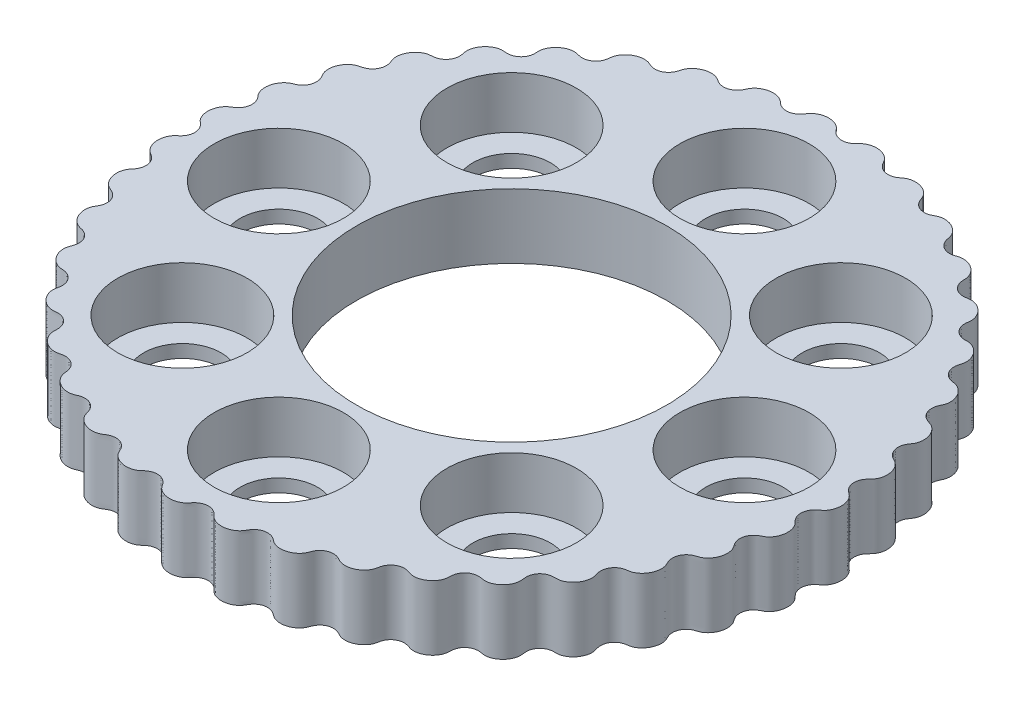
from build123d import *

# Parameters (mm, degrees)
BOSS_EXTRUDE1_START = -5
BOSS_EXTRUDE1_DEPTH = 5
SKETCH2_R           = 12
CUT_EXTRUDE1_DEPTH  = 37.393837929
HOLE1_D             = 6
HOLE1_CBORE_D       = 10
HOLE1_CBORE_DEPTH   = 4


# Read off the part's stored shape, not the designer's step: Boss-Extrude1
with BuildPart() as part:
    # Boss-Extrude1 outline → Boss-Extrude1 (new body)
    with BuildSketch(Plane(origin=(0, 0, 0), x_dir=(1, 0, 0), z_dir=(0, 1, 0)).offset(BOSS_EXTRUDE1_START)):
        with BuildLine():
            add(Edge.make_bspline(
                [(-24.5, 0), (-24.5, -0.032701576), (-24.503643768, -0.098935065), (-24.520100091, -0.231557515), (-24.563306694, -0.37104905), (-24.630474901, -0.517913129), (-24.723536717, -0.659065523), (-24.842442783, -0.7928284), (-24.987483311, -0.908750967), (-25.151066473, -1.063330899), (-25.293016734, -1.285136586), (-25.404935247, -1.590500327), (-25.442358966, -1.973679704), (-25.38823868, -2.341450404), (-25.249908885, -2.66266914), (-25.066237712, -2.923851671), (-24.843285183, -3.097823526), (-24.551710808, -3.251747242), (-24.291807967, -3.54096186), (-24.156855516, -3.887170811), (-24.159964194, -4.245303416), (-24.253524536, -4.539087991), (-24.385168226, -4.771968939), (-24.638807172, -5.019239879), (-24.797525081, -5.397374474), (-24.830645525, -5.836257731), (-24.734992758, -6.249812375), (-24.581951422, -6.558483237), (-24.390234292, -6.791981719), (-24.184935025, -6.970555692), (-23.94085472, -7.065125184), (-23.707134872, -7.165908686), (-23.508700988, -7.319059018), (-23.350412864, -7.502267836), (-23.216949119, -7.764654986), (-23.163202282, -8.071712168), (-23.205655501, -8.393877156), (-23.34132918, -8.675141437), (-23.491049397, -8.894217401), (-23.576162075, -9.177606246), (-23.598316799, -9.499805744), (-23.534839483, -9.847196252), (-23.379813294, -10.190594912), (-23.178906933, -10.450991492), (-22.96756741, -10.630525294), (-22.764880157, -10.74275699), (-22.589184753, -10.797744012), (-22.386815398, -10.837748422), (-22.190086382, -10.904416667), (-21.996608783, -11.016922345), (-21.76513704, -11.234569899), (-21.595631093, -11.535075827), (-21.539371142, -11.906162159), (-21.632077893, -12.284690709), (-21.764581584, -12.549564382), (-21.789593438, -12.787020834), (-21.782131101, -13.023382403), (-21.727181437, -13.289110069), (-21.595061725, -13.600213652), (-21.343195349, -13.928402362), (-21.015174886, -14.168242877), (-20.694719618, -14.280355121), (-20.431319471, -14.282746613), (-20.221891393, -14.310542506), (-20.031331556, -14.36570747), (-19.783881314, -14.493589438), (-19.520218355, -14.750869641), (-19.36908006, -15.105193451), (-19.358026871, -15.501401929), (-19.462600447, -15.833461084), (-19.464472528, -16.137599176), (-19.379692521, -16.467079717), (-19.20413738, -16.797533991), (-18.949742957, -17.076011559), (-18.638873722, -17.274855119), (-18.321682795, -17.389270014), (-18.023392019, -17.405995869), (-17.688466453, -17.348112947), (-17.287573892, -17.422084373), (-16.911103901, -17.660362808), (-16.700986872, -18.014992063), (-16.640562072, -18.330352656), (-16.644508032, -18.592116865), (-16.666618795, -18.826019771), (-16.606844181, -19.103025486), (-16.448349509, -19.431276821), (-16.17675271, -19.74491714), (-15.826597431, -19.975949914), (-15.461825487, -20.085392003), (-15.163898291, -20.094151901), (-14.9520024, -20.04983025), (-14.788464283, -20.001991557), (-14.620523702, -19.975251295), (-14.451471287, -19.973404927), (-14.183542561, -20.011245033), (-13.906637721, -20.136429947), (-13.663310323, -20.365573716), (-13.518257551, -20.65830567), (-13.463367138, -20.873569035), (-13.44582885, -21.065140218), (-13.425857037, -21.227322128), (-13.36659396, -21.418479957), (-13.257220726, -21.627293987), (-13.067172206, -21.864497208), (-12.77386147, -22.09369711), (-12.447891742, -22.2381968), (-12.113896745, -22.296901279), (-11.843875803, -22.283192923), (-11.645465782, -22.233946593), (-11.478617233, -22.156632069), (-11.326566326, -22.091661028), (-11.144171953, -22.042843551), (-10.932809135, -22.022823125), (-10.645185301, -22.057480963), (-10.36313677, -22.186462391), (-10.140796185, -22.389999876), (-9.978092873, -22.655161269), (-9.908251519, -22.873925164), (-9.860799898, -23.07866618), (-9.752494313, -23.294506537), (-9.598536128, -23.496595421), (-9.355144664, -23.704201957), (-9.012124755, -23.875609555), (-8.66866478, -23.951388952), (-8.351201207, -23.946909864), (-8.105808933, -23.889980993), (-7.933631169, -23.815733854), (-7.793147102, -23.723462426), (-7.667924542, -23.641344217), (-7.516461234, -23.566205542), (-7.337194888, -23.508022186), (-7.051498572, -23.471278437), (-6.693066545, -23.537697092), (-6.365459431, -23.748903968), (-6.15838792, -24.04864498), (-6.064280118, -24.29232027), (-5.94266348, -24.494976448), (-5.777090154, -24.672238128), (-5.520247176, -24.854790009), (-5.157666697, -24.994457904), (-4.786540585, -25.037338822), (-4.432716177, -24.988008571), (-4.169505595, -24.884468598), (-3.995068316, -24.768805386), (-3.865593658, -24.645272707), (-3.752469282, -24.54658182), (-3.609348281, -24.448937287), (-3.431420322, -24.364696016), (-3.162117221, -24.297268518), (-2.858943588, -24.3139032), (-2.575335523, -24.420915571), (-2.355767454, -24.590000535), (-2.22462643, -24.736967072), (-2.127382807, -24.881995349), (-2.043045448, -25.009111347), (-1.905164763, -25.158865949), (-1.698793066, -25.308147213), (-1.397681127, -25.439850098), (-1.001127395, -25.502965211), (-0.629360305, -25.465313735), (-0.307665354, -25.346652244), (-0.083554069, -25.198652632), (0.053247698, -25.060384837), (0.177849714, -24.89257545), (0.322474928, -24.735152105), (0.518785356, -24.595698929), (0.766051201, -24.499605539), (1.014597762, -24.467449994), (1.263114223, -24.492889288), (1.493381367, -24.576146017), (1.712279038, -24.70975623), (1.890397186, -24.901293648), (2.076369969, -25.098671242), (2.328663959, -25.228025659), (2.632218036, -25.321000864), (2.995349224, -25.341506798), (3.391344631, -25.269405651), (3.72570889, -25.09977043), (3.95025068, -24.900993909), (4.079020757, -24.71434247), (4.149949593, -24.578033634), (4.268658204, -24.384436791), (4.484903459, -24.15511427), (4.801886057, -23.992662584), (5.188898808, -23.961589643), (5.490584075, -24.041418853), (5.694287949, -24.146931727), (5.850720079, -24.266746804), (5.981065842, -24.369719817), (6.160403868, -24.467085708), (6.390667661, -24.53903357), (6.697487132, -24.571284513), (7.070614177, -24.521629504), (7.403348735, -24.388735097), (7.6790332, -24.191057237), (7.858081607, -23.988606232), (7.962893068, -23.812724541), (8.023941866, -23.63894966), (8.081282323, -23.483450289), (8.170475451, -23.317503843), (8.299773519, -23.150624459), (8.51964793, -22.965662498), (8.804465664, -22.847481619), (9.105365548, -22.822461222), (9.411188141, -22.884555599), (9.621121013, -22.98349187), (9.801541356, -23.093233385), (10.031431121, -23.167757955), (10.283339182, -23.1991326), (10.602501238, -23.170425043), (10.96378713, -23.044588284), (11.259514061, -22.852072044), (11.476293498, -22.621632584), (11.630063605, -22.37488496), (11.708363888, -22.123831617), (11.736343173, -21.861885355), (11.844524339, -21.617832178), (12.032186592, -21.353405878), (12.328822633, -21.137070409), (12.705385709, -21.042956367), (13.066996754, -21.097160652), (13.307409949, -21.19699775), (13.536665533, -21.25294426), (13.778370044, -21.258651437), (14.086089242, -21.203595279), (14.43196453, -21.045493553), (14.721938061, -20.816198287), (14.93081781, -20.535754089), (15.065261041, -20.246125029), (15.104422063, -19.966040419), (15.091955165, -19.636584102), (15.212438812, -19.266876657), (15.444788913, -18.97689371), (15.75647692, -18.800505601), (16.057689258, -18.734631758), (16.325183355, -18.732180031), (16.666141932, -18.828207188), (17.072976986, -18.776617763), (17.469630132, -18.585866424), (17.779960022, -18.296264144), (17.97076611, -18.009395532), (18.077132106, -17.726619708), (18.129143612, -17.459541547), (18.089017182, -17.200873303), (18.059424361, -16.948069734), (18.092832048, -16.699643254), (18.17234206, -16.470956663), (18.332828079, -16.224182753), (18.571854487, -16.024097886), (18.872076197, -15.89976473), (19.18349984, -15.876607566), (19.448092293, -15.89674078), (19.736076902, -15.828769616), (20.026191917, -15.686865131), (20.295309173, -15.458206322), (20.515197288, -15.152256297), (20.640263684, -14.848072182), (20.69008429, -14.575281206), (20.685945429, -14.343634509), (20.645728386, -14.163984922), (20.579190013, -13.96873148), (20.538550918, -13.765032883), (20.539232228, -13.541223617), (20.611966947, -13.231930145), (20.787450811, -12.934860177), (21.080687227, -12.70058262), (21.45485465, -12.591586679), (21.750490612, -12.573906328), (21.968640179, -12.476853149), (22.16960689, -12.352216642), (22.372265436, -12.171772873), (22.575637174, -11.901807468), (22.733936037, -11.519595898), (22.777646208, -11.115603109), (22.714525982, -10.78202278), (22.584907643, -10.552709026), (22.504249054, -10.357454845), (22.456753447, -10.164837398), (22.443729315, -9.88663199), (22.534743381, -9.52960091), (22.765917465, -9.221603372), (23.103644685, -9.013803993), (23.443302747, -8.93848596), (23.707993388, -8.787794965), (23.950263889, -8.550142022), (24.150007497, -8.231911496), (24.261724158, -7.874028052), (24.281866529, -7.502915555), (24.224809831, -7.211523413), (24.139392489, -7.004744406), (24.011104247, -6.82226928), (23.85764662, -6.606828878), (23.729838273, -6.261894362), (23.75128129, -5.814263941), (23.951133682, -5.456586685), (24.195158444, -5.24573212), (24.423265356, -5.118668919), (24.637193058, -5.020649097), (24.847031963, -4.83052053), (25.052168714, -4.529069776), (25.187932761, -4.137109686), (25.213001365, -3.718333125), (25.125395898, -3.347743358), (24.98406187, -3.085338558), (24.839762203, -2.92397556), (24.716507017, -2.806333566), (24.582959914, -2.64135003), (24.435425815, -2.363628599), (24.381922696, -2.017749906), (24.46873838, -1.650115993), (24.649609455, -1.378154529), (24.808636546, -1.22290269), (24.965741318, -1.111943307), (25.096247422, -1.01354666), (25.232180719, -0.866657231), (25.358361579, -0.667519532), (25.468779713, -0.384324166), (25.52063487, -0.015694947), (25.482799072, 0.338859248), (25.366652836, 0.65746471), (25.219778481, 0.884459885), (25.077933052, 1.031673708), (24.927554275, 1.137515001), (24.795258703, 1.236705561), (24.661779406, 1.370249009), (24.538753325, 1.543277464), (24.424946329, 1.809683062), (24.395606022, 2.118427635), (24.460685221, 2.412754545), (24.60895642, 2.686249863), (24.763487185, 2.856131501), (24.917080183, 2.999593705), (25.049860193, 3.201302755), (25.147903627, 3.435675741), (25.206010818, 3.750259953), (25.182955688, 4.133028667), (25.076862759, 4.468366378), (24.914260908, 4.741064395), (24.742269621, 4.925121935), (24.591886346, 5.037116558), (24.441737459, 5.112647712), (24.308008585, 5.180030924), (24.167201929, 5.273626283), (24.027175357, 5.39977741), (23.852494496, 5.628818837), (23.730781566, 5.97243798), (23.749873998, 6.361759057), (23.905908744, 6.69096743), (24.069879874, 6.894305009), (24.184586694, 7.100946871), (24.255321128, 7.332965465), (24.285005414, 7.646671699), (24.224682653, 8.030512224), (24.076266101, 8.37336121), (23.856641921, 8.655124843), (23.635374022, 8.831310243), (23.447990289, 8.924556985), (23.276267209, 8.974922862), (23.134229934, 9.023544198), (22.978107294, 9.098662652), (22.816193845, 9.210620433), (22.623144857, 9.410113226), (22.485950648, 9.680969687), (22.436801911, 9.98008468), (22.473435608, 10.254787922), (22.535133774, 10.441849709), (22.612106988, 10.598584097), (22.680029397, 10.735179487), (22.740790768, 10.929462915), (22.766895904, 11.182826769), (22.730409073, 11.509450231), (22.58680291, 11.884437962), (22.368321669, 12.187578491), (22.104717613, 12.406852976), (21.864496153, 12.526948008), (21.676356123, 12.576297924), (21.46873147, 12.600303477), (21.260084037, 12.646829282), (21.041148938, 12.747104754), (20.834288694, 12.913187543), (20.682161601, 13.112348827), (20.57992466, 13.340281649), (20.536879428, 13.581322073), (20.543127815, 13.837701159), (20.619935504, 14.087734533), (20.697897472, 14.347478833), (20.683785527, 14.630648163), (20.612539781, 14.940016116), (20.448750982, 15.264743668), (20.188340354, 15.571630982), (19.874283338, 15.776390436), (19.589894021, 15.871482493), (19.36387865, 15.889707248), (19.21037394, 15.882982814), (18.983382548, 15.888963222), (18.676671315, 15.96152072), (18.377464761, 16.154744804), (18.15698073, 16.474328537), (18.075213067, 16.775518481), (18.064704895, 17.004712505), (18.090236118, 17.200114634), (18.114255588, 17.364492919), (18.108933156, 17.568503025), (18.05612257, 17.803915684), (17.930651666, 18.085777039), (17.701086961, 18.384107556), (17.419631546, 18.605829356), (17.110599677, 18.74575099), (16.845749807, 18.799595204), (16.641024681, 18.802435079), (16.460004278, 18.768421708), (16.296666174, 18.74032546), (16.108358498, 18.734588923), (15.899193741, 18.763115029), (15.629078331, 18.861033277), (15.384315299, 19.048582015), (15.212178066, 19.296648554), (15.113024392, 19.592546165), (15.093725088, 19.823828753), (15.098560071, 20.03495203), (15.048167193, 20.271307402), (14.949392398, 20.505157697), (14.764958995, 20.76721217), (14.475345377, 21.017185785), (14.160763373, 21.177043605), (13.852808866, 21.249571591), (13.562235143, 21.259376095), (13.30566185, 21.201675588), (13.064820816, 21.094926346), (12.799373544, 21.066575462), (12.476542238, 21.096870076), (12.140863754, 21.245583401), (11.871066975, 21.524628459), (11.737189157, 21.864887947), (11.70343971, 22.123010648), (11.637276173, 22.349525601), (11.521374296, 22.56170531), (11.319844054, 22.800676046), (11.009992083, 23.021172245), (10.666434964, 23.157658483), (10.319123439, 23.198344141), (10.001074155, 23.169970497), (9.738921219, 23.06385688), (9.459849112, 22.888328302), (9.079427651, 22.80779713), (8.7121173, 22.864012386), (8.403512006, 23.045732045), (8.195848426, 23.273651905), (8.059966286, 23.504068249), (7.972655392, 23.847358434), (7.72457982, 24.173907852), (7.361059652, 24.422054498), (6.95509901, 24.546020162), (6.61125944, 24.567839428), (6.313185502, 24.518577693), (6.0558803, 24.430093425), (5.851919907, 24.266019209), (5.647785094, 24.113974915), (5.415939136, 24.018685882), (5.178139894, 23.973191799), (4.884194742, 23.988777252), (4.591403927, 24.095715796), (4.333607328, 24.293533833), (4.157819468, 24.551649253), (4.042964, 24.790870543), (3.840115486, 25.00629919), (3.57217028, 25.186602346), (3.239592013, 25.305346014), (2.864687967, 25.342810665), (2.538722463, 25.299039624), (2.277564624, 25.205798962), (2.079018763, 25.08640001), (1.943541454, 24.961755633), (1.80772045, 24.806509148), (1.651644126, 24.669459773), (1.457485356, 24.558134248), (1.153262831, 24.466457642), (0.808237415, 24.469878145), (0.458720569, 24.606680321), (0.177228565, 24.8762107), (0.014104886, 25.123398433), (-0.179008444, 25.263802311), (-0.387425424, 25.375532062), (-0.64502043, 25.460827345), (-0.980501672, 25.501979005), (-1.3906588, 25.44797801), (-1.762384852, 25.283846424), (-2.019725852, 25.06240614), (-2.153514599, 24.835500254), (-2.282270734, 24.668017887), (-2.425323022, 24.530573817), (-2.659730713, 24.380184241), (-3.014425698, 24.280462027), (-3.396760744, 24.326646936), (-3.745591148, 24.515207033), (-3.980675088, 24.771710191), (-4.243474745, 24.925598954), (-4.570491403, 25.016613411), (-4.945822106, 25.030456217), (-5.311853099, 24.948340676), (-5.642960785, 24.780135857), (-5.867321327, 24.585186548), (-6.002816065, 24.407576532), (-6.082617554, 24.239649703), (-6.14301484, 24.102783457), (-6.256496448, 23.906200792), (-6.475873394, 23.663671211), (-6.840745807, 23.476485128), (-7.249746712, 23.470510852), (-7.554708148, 23.576499687), (-7.778642942, 23.710460735), (-7.97057878, 23.84674845), (-8.240096296, 23.933407536), (-8.603751578, 23.960355455), (-9.011048576, 23.881963245), (-9.386262289, 23.69431436), (-9.663394675, 23.433179759), (-9.819999514, 23.179604633), (-9.887615111, 22.973972837), (-9.927858643, 22.808421022), (-10.003932066, 22.610288693), (-10.170623241, 22.343654916), (-10.443360151, 22.124335422), (-10.805135879, 22.015628997), (-11.131121497, 22.036235574), (-11.345120677, 22.096309002), (-11.519785854, 22.176883073), (-11.670254134, 22.240725408), (-11.86543894, 22.285027571), (-12.10100616, 22.294752598), (-12.401488241, 22.248793523), (-12.746677069, 22.109393755), (-13.034823572, 21.899354859), (-13.252680184, 21.639473794), (-13.37583477, 21.398784109), (-13.432414471, 21.202337985), (-13.448890425, 21.019185409), (-13.468638962, 20.855017623), (-13.517543751, 20.672648172), (-13.605868504, 20.479588078), (-13.779663067, 20.247823619), (-14.03235857, 20.068030622), (-14.319788011, 19.977208044), (-14.630778836, 19.968850478), (-14.855177465, 20.017726414), (-15.056217557, 20.079018883), (-15.297291867, 20.093166768), (-15.549288022, 20.06089725), (-15.850782784, 19.953937568), (-16.170749227, 19.742596354), (-16.408121379, 19.483055664), (-16.562993567, 19.205894045), (-16.636405002, 18.964919235), (-16.658213131, 18.778687027), (-16.648555408, 18.610888855), (-16.640042858, 18.461385459), (-16.650688468, 18.292646221), (-16.689917153, 18.108302836), (-16.800920545, 17.842497438), (-17.037637171, 17.565267236), (-17.384339404, 17.387127867), (-17.747460679, 17.357638284), (-18.005539947, 17.397969133), (-18.241847255, 17.394000319), (-18.478149901, 17.339257227), (-18.764673266, 17.208122286), (-19.066935611, 16.963969633), (-19.289651902, 16.664019821), (-19.423865696, 16.332942001), (-19.465822817, 16.053226394), (-19.452895818, 15.844320227), (-19.410654107, 15.670415928), (-19.381738084, 15.523092832), (-19.368726571, 15.350330728), (-19.38472079, 15.154141387), (-19.460945838, 14.887215038), (-19.626895904, 14.632969924), (-19.861350074, 14.440832504), (-20.117567821, 14.33518963), (-20.31041925, 14.295080559), (-20.484644354, 14.283368635), (-20.636902696, 14.273899706), (-20.835540859, 14.229386137), (-21.068018569, 14.125326036), (-21.332644782, 13.930413546), (-21.585602613, 13.618579734), (-21.738896049, 13.277774006), (-21.797008456, 12.939895424), (-21.780905842, 12.671748633), (-21.729597034, 12.484236566), (-21.646551082, 12.292214429), (-21.582568104, 12.088742727), (-21.55981856, 11.848093825), (-21.60985639, 11.526335571), (-21.752983116, 11.242122591), (-21.975402435, 11.023555206), (-22.25537935, 10.872576219), (-22.510214023, 10.813187023), (-22.774210956, 10.751372297), (-23.012355689, 10.59728615), (-23.244677294, 10.381095354), (-23.443992356, 10.076771402), (-23.579581768, 9.697928802), (-23.59989723, 9.323530726), (-23.540090606, 9.02973991), (-23.442899484, 8.824874227), (-23.360330868, 8.695306853), (-23.252003317, 8.495767513), (-23.16144164, 8.193906542), (-23.179105483, 7.838181557), (-23.34555955, 7.487408485), (-23.565492435, 7.265944301), (-23.758729336, 7.142207458), (-23.940730999, 7.066590856), (-24.095107356, 7.005215414), (-24.269158966, 6.898608067), (-24.446637733, 6.735178668), (-24.628701078, 6.484671358), (-24.772762898, 6.134520477), (-24.823520925, 5.777352144), (-24.788138803, 5.437644156), (-24.700089215, 5.179912993), (-24.597259427, 5.001117625), (-24.474854131, 4.860415749), (-24.368107944, 4.729862168), (-24.270037499, 4.565584266), (-24.192790883, 4.36600647), (-24.148702855, 4.080575963), (-24.195587289, 3.776774954), (-24.328328539, 3.511121641), (-24.537077521, 3.280103731), (-24.731113725, 3.151313906), (-24.9204604, 3.044948594), (-25.067946603, 2.903334113), (-25.171977804, 2.772634595), (-25.28192253, 2.58855705), (-25.384681037, 2.327359303), (-25.442050961, 1.989113877), (-25.41273705, 1.624513221), (-25.302488262, 1.302409631), (-25.155369228, 1.068828132), (-25.003788738, 0.92489868), (-24.861104405, 0.803305369), (-24.749137309, 0.699511204), (-24.641312065, 0.527598509), (-24.550490368, 0.376428536), (-24.510248462, 0.164569644), (-24.500037563, 0.05522408), (-24.500000245, 0.000716469)],
                knots=[0.067666644, 0.067666644, 0.067666644, 0.067666644, 0.067666644, 0.068384525, 0.069102406, 0.069820287, 0.070538168, 0.071421007, 0.072303847, 0.073186687, 0.074069526, 0.075663586, 0.077257645, 0.079287793, 0.08131794, 0.082593638, 0.083869336, 0.085257156, 0.086644976, 0.088818664, 0.091044217, 0.092148055, 0.093251893, 0.094655618, 0.096059344, 0.098783864, 0.100818131, 0.102852398, 0.104037285, 0.105222172, 0.106566772, 0.107911371, 0.108976353, 0.110041335, 0.11126547, 0.112489605, 0.114477485, 0.115880621, 0.117283757, 0.118381293, 0.11947883, 0.121425739, 0.123372649, 0.124975842, 0.126579035, 0.127594759, 0.128610483, 0.129335069, 0.130059656, 0.13150883, 0.132526666, 0.133544502, 0.136038431, 0.137927708, 0.139389661, 0.140851614, 0.141612703, 0.142373791, 0.143895968, 0.145942594, 0.147989221, 0.150092297, 0.151522402, 0.152237455, 0.152952507, 0.154103779, 0.15525505, 0.157496311, 0.15977388, 0.161189651, 0.162605422, 0.164039653, 0.165473884, 0.16756908, 0.169664276, 0.171056797, 0.172449319, 0.17386821, 0.175287102, 0.177453396, 0.179996183, 0.182056602, 0.18277897, 0.183501337, 0.184946073, 0.186499114, 0.188052156, 0.190377238, 0.19270232, 0.194342788, 0.195163022, 0.195983256, 0.196781535, 0.197579815, 0.198378095, 0.199176375, 0.201896006, 0.203215219, 0.204534433, 0.205309298, 0.206084162, 0.206859027, 0.207633891, 0.209083646, 0.210533401, 0.212580076, 0.214626752, 0.215764154, 0.216901555, 0.217684808, 0.218468061, 0.219251313, 0.220034566, 0.221252749, 0.222470932, 0.224697751, 0.225787335, 0.22687692, 0.228317271, 0.229037447, 0.229757623, 0.231433215, 0.233108807, 0.235037779, 0.236966751, 0.23802442, 0.23908209, 0.239791888, 0.240501687, 0.241211485, 0.241921284, 0.242990513, 0.244059742, 0.24664089, 0.248666879, 0.250124635, 0.250853513, 0.251582391, 0.253135161, 0.254687931, 0.25678004, 0.258872149, 0.260132575, 0.261393, 0.262103899, 0.262814797, 0.263525695, 0.264236593, 0.265383261, 0.26652993, 0.268746926, 0.269884368, 0.271021811, 0.271745191, 0.272468571, 0.273191951, 0.273915331, 0.275590025, 0.277264719, 0.279359367, 0.281454014, 0.282580004, 0.283705995, 0.284415514, 0.285125033, 0.286544071, 0.287741584, 0.288939097, 0.290102412, 0.291265726, 0.292418015, 0.293570304, 0.294896123, 0.296221941, 0.297533289, 0.298844637, 0.300928647, 0.303012657, 0.305102586, 0.30583198, 0.306561373, 0.307290766, 0.308020159, 0.310134642, 0.312461837, 0.313832341, 0.315202845, 0.31599054, 0.316778235, 0.317565931, 0.318353626, 0.319839929, 0.321326232, 0.323372892, 0.325419552, 0.326556766, 0.32769398, 0.328479126, 0.329264273, 0.33004942, 0.330834566, 0.332039904, 0.333245242, 0.335450599, 0.336560183, 0.337669767, 0.339110813, 0.339831336, 0.340551859, 0.342227219, 0.343902578, 0.345831443, 0.347760307, 0.348818958, 0.349877608, 0.351296011, 0.352714413, 0.353786522, 0.35485863, 0.357437011, 0.359473842, 0.360924648, 0.361650051, 0.362375454, 0.363928416, 0.365481378, 0.367511525, 0.369541673, 0.370817371, 0.372093068, 0.373480933, 0.374868797, 0.377042236, 0.37926811, 0.38037185, 0.38147559, 0.382879333, 0.384283076, 0.387007593, 0.38904186, 0.391076127, 0.392261014, 0.393445901, 0.394790487, 0.396135074, 0.397200124, 0.398265175, 0.399489214, 0.400713253, 0.402701078, 0.40410429, 0.405507501, 0.406605033, 0.407702564, 0.409649474, 0.411596384, 0.413199578, 0.414802771, 0.415818497, 0.416834223, 0.417558779, 0.418283336, 0.419732448, 0.420750322, 0.421768195, 0.424262225, 0.426151521, 0.427613432, 0.429075344, 0.429836433, 0.430597522, 0.4321197, 0.434166326, 0.436212953, 0.438316027, 0.439746131, 0.440461183, 0.441176235, 0.442327449, 0.443478664, 0.445719896, 0.447997631, 0.449413395, 0.450829159, 0.452263387, 0.453697616, 0.455792812, 0.457888007, 0.459280531, 0.460673054, 0.461382502, 0.462091951, 0.463510847, 0.465677255, 0.468219851, 0.470280377, 0.471002734, 0.471725092, 0.473169806, 0.474722848, 0.47627589, 0.478600837, 0.480925784, 0.482566215, 0.483386431, 0.484206647, 0.485004816, 0.485802985, 0.487399324, 0.490118928, 0.491438332, 0.492757736, 0.493532641, 0.494307547, 0.495082453, 0.495857358, 0.497307245, 0.498757133, 0.500803808, 0.502850483, 0.503987885, 0.505125286, 0.505908541, 0.506691797, 0.507475052, 0.508258308, 0.509476471, 0.510694635, 0.512921334, 0.514010995, 0.515100657, 0.516541008, 0.517261184, 0.51798136, 0.519656951, 0.521332543, 0.523261514, 0.525190486, 0.52624816, 0.527305833, 0.528015628, 0.528725423, 0.529435218, 0.530145012, 0.531214238, 0.532283465, 0.534864663, 0.536890665, 0.538348394, 0.539077258, 0.539806123, 0.541358894, 0.542911665, 0.545003774, 0.547095883, 0.548356309, 0.549616735, 0.550327659, 0.551038583, 0.551749507, 0.552460431, 0.553606967, 0.554753504, 0.55697057, 0.558108041, 0.559245512, 0.559968901, 0.560692289, 0.561415678, 0.562139066, 0.563813758, 0.565488451, 0.567583099, 0.569677747, 0.570803738, 0.57192973, 0.572639232, 0.573348733, 0.574767736, 0.575965326, 0.577162916, 0.578326123, 0.579489331, 0.580641702, 0.581794073, 0.583119874, 0.584445674, 0.585757024, 0.587068373, 0.589152252, 0.591236132, 0.593325935, 0.594055294, 0.594784654, 0.595514013, 0.596243372, 0.598357525, 0.600684721, 0.602055409, 0.603426096, 0.604213844, 0.605001593, 0.605789341, 0.606577089, 0.608063526, 0.609549963, 0.611596624, 0.613643284, 0.614780497, 0.61591771, 0.616702867, 0.617488025, 0.618273182, 0.61905834, 0.6202636, 0.62146886, 0.623674189, 0.624783841, 0.625893493, 0.627334544, 0.62805507, 0.628775595, 0.630450954, 0.632126312, 0.634055176, 0.635984041, 0.637042694, 0.638101348, 0.639519749, 0.64093815, 0.642010283, 0.643082416, 0.645660727, 0.647697623, 0.649148405, 0.649873796, 0.650599187, 0.652152149, 0.653705112, 0.655735259, 0.657765407, 0.659041104, 0.660316802, 0.66170471, 0.663092619, 0.66526581, 0.667492005, 0.668595646, 0.669699287, 0.671103049, 0.67250681, 0.675231323, 0.67726559, 0.679299857, 0.680484744, 0.681669632, 0.683014205, 0.684358778, 0.685423897, 0.686489016, 0.687712959, 0.688936902, 0.690924673, 0.69232796, 0.693731246, 0.694828773, 0.6959263, 0.69787321, 0.699820121, 0.701423314, 0.703026508, 0.704042236, 0.705057965, 0.705782491, 0.706507016, 0.707956068, 0.708973979, 0.70999189, 0.712486021, 0.714375334, 0.715837205, 0.717299075, 0.718060165, 0.718821254, 0.720343433, 0.722390059, 0.724436686, 0.726539757, 0.727969861, 0.728684912, 0.729399964, 0.730551121, 0.731702279, 0.733943484, 0.736221383, 0.73763714, 0.739052897, 0.740487123, 0.741921349, 0.744016545, 0.746111741, 0.747504266, 0.748896791, 0.749606241, 0.750315692, 0.751025143, 0.751734594, 0.753901116, 0.75644352, 0.758504153, 0.7592265, 0.759948847, 0.761393542, 0.762946583, 0.764499625, 0.766824437, 0.769149249, 0.770789644, 0.771609842, 0.772430039, 0.773228098, 0.774026157, 0.775622274, 0.778341852, 0.779661446, 0.780981039, 0.781755986, 0.782530933, 0.78330588, 0.784080826, 0.785530846, 0.786980865, 0.789027541, 0.791074216, 0.792211617, 0.793349017, 0.794132276, 0.794915534, 0.795698793, 0.796482051, 0.797700195, 0.798918338, 0.801144918, 0.802234657, 0.803324395, 0.804764747, 0.805484923, 0.806205099, 0.807880689, 0.80955628, 0.811485251, 0.813414222, 0.8144719, 0.815529578, 0.816239369, 0.81694916, 0.817658951, 0.818368742, 0.819437966, 0.820507189, 0.823088436, 0.825114451, 0.826572154, 0.827301005, 0.828029856, 0.829582628, 0.8311354, 0.833227509, 0.835319618, 0.836580044, 0.83784047, 0.83855142, 0.83926237, 0.83997332, 0.84068427, 0.841830675, 0.84297708, 0.845194216, 0.846331715, 0.847469215, 0.848192612, 0.848916009, 0.849639405, 0.850362802, 0.852037492, 0.853712183, 0.855806832, 0.85790148, 0.859027474, 0.860153467, 0.860862951, 0.861572435, 0.862991402, 0.864189069, 0.865386736, 0.867712936, 0.86886539, 0.870017844, 0.871343626, 0.872669408, 0.873980759, 0.87529211, 0.877375859, 0.879459607, 0.881549284, 0.88227861, 0.883007935, 0.883737261, 0.884466587, 0.886580408, 0.888907606, 0.890278477, 0.891649349, 0.89243715, 0.893224951, 0.894012752, 0.894800553, 0.896287125, 0.897773696, 0.899840974, 0.901908251, 0.903046745, 0.904185238, 0.904984226, 0.905783214, 0.906582202, 0.90738119, 0.908598845, 0.909816501, 0.912014313, 0.913081271, 0.914148228, 0.915662834, 0.916420137, 0.91717744, 0.918002263, 0.918827085, 0.920476729, 0.922465691, 0.924454653, 0.925668811, 0.926882968, 0.927646963, 0.928410957, 0.929174952, 0.929938946, 0.931135524, 0.932332102, 0.932332102, 0.932332102, 0.932332102, 0.932332102], degree=4))
            Line((-24.500000245, 0.000716469), (-24.5, 0))
        make_face()
    extrude(amount=BOSS_EXTRUDE1_DEPTH)

    # Sketch2 → Cut-Extrude1 (cut, through all)
    with BuildSketch(Plane.XZ.offset(5)):
        with Locations(Location((0, 0, 0), (0, 0, 270))):
            Circle(SKETCH2_R)
    extrude(amount=-CUT_EXTRUDE1_DEPTH, mode=Mode.SUBTRACT)

    # Hole1 (through all)
    with Locations(Plane(origin=(0, 0, 0), x_dir=(1, 0, 0), z_dir=(0, 1, 0))):
        with Locations((18, 0), (12.727922061, -12.727922061), (0, -18), (-12.727922061, -12.727922061), (-18, 0), (-12.727922061, 12.727922061), (0, 18), (12.727922061, 12.727922061)):
            CounterBoreHole(HOLE1_D / 2, HOLE1_CBORE_D / 2, HOLE1_CBORE_DEPTH)


solid = part.part
